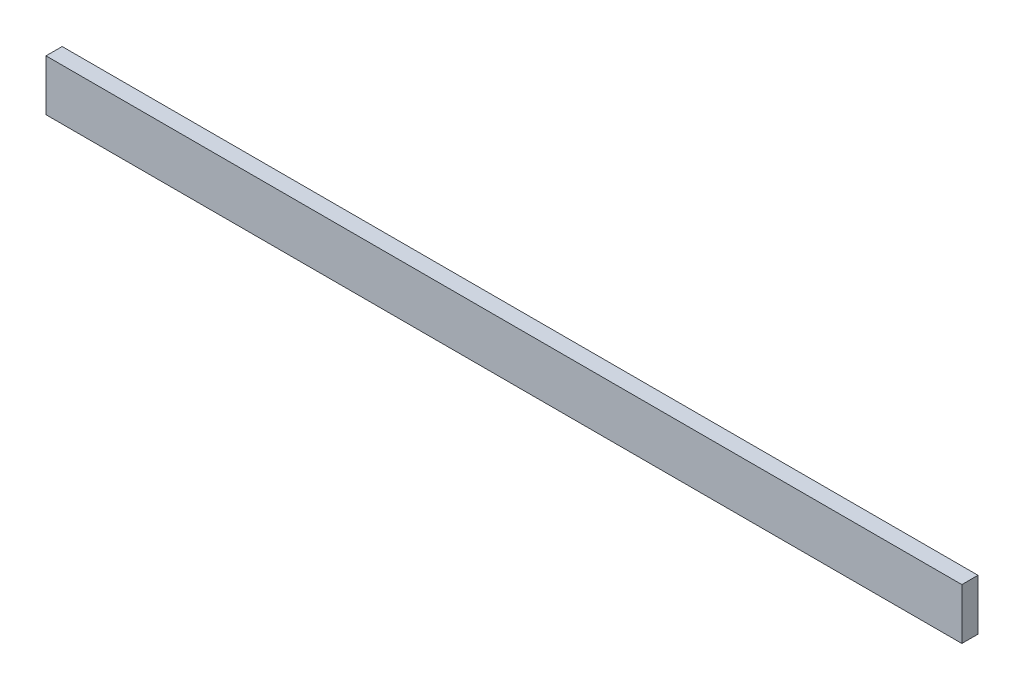
from build123d import *

# Parameters (mm, degrees)
SKETCH1_W           = 1077.2
SKETCH1_H           = 19
BOSS_EXTRUDE1_DEPTH = 60


with BuildPart() as part:
    # Sketch1 → Boss-Extrude1 (new body)
    with BuildSketch(Plane(origin=(0, 0, 0), x_dir=(1, 0, 0), z_dir=(0, 1, 0))):
        with Locations((538.6, 0)):
            Rectangle(SKETCH1_W, SKETCH1_H)
    extrude(amount=BOSS_EXTRUDE1_DEPTH)


solid = part.part
